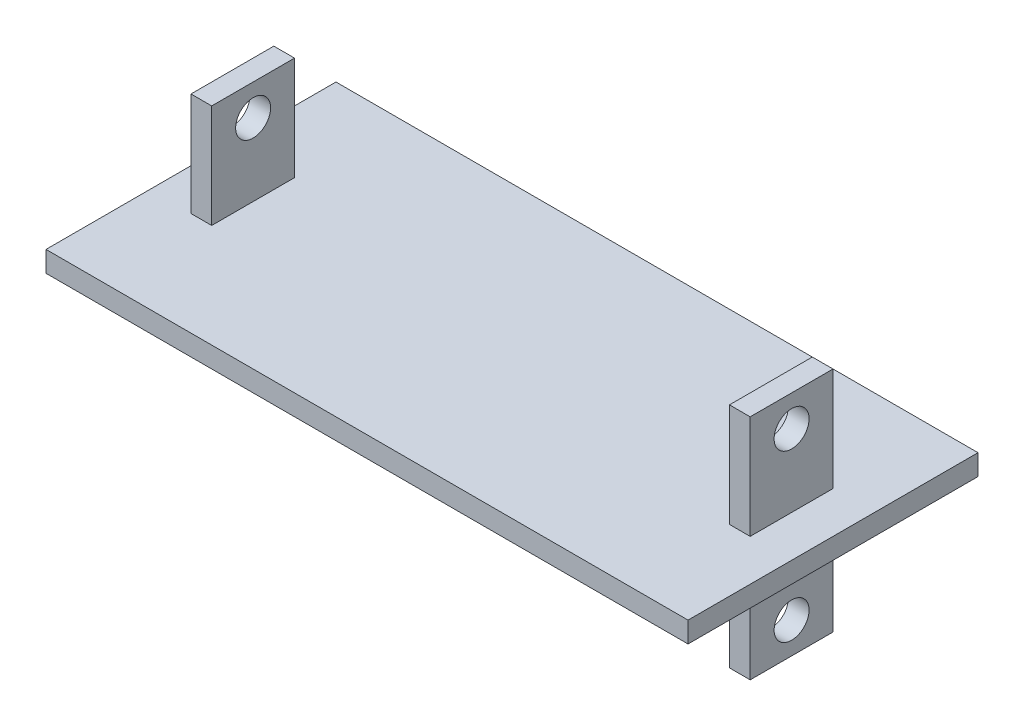
from build123d import *

# Parameters (mm, degrees)
SKETCH1_W               = 196.85
SKETCH1_H               = 88.9
BOSS_EXTRUDE1_DEPTH     = 3.175
SKETCH1_3_W             = 6.35
SKETCH1_3_H             = 25.4
BOSS_EXTRUDE2_DEPTH     = 34.925
CUT_EXTRUDE1_DEPTH      = 193.631203664
CUT_EXTRUDE1_DEPTH_BACK = 193.631203664
SKETCH2_R               = 5.3578125


with BuildPart() as part:
    # Sketch1 → Boss-Extrude1 (new, symmetric)
    with BuildSketch(Plane(origin=(0, 0, 0), x_dir=(1, 0, 0), z_dir=(0, 1, 0))):
        Rectangle(SKETCH1_W, SKETCH1_H)
    extrude(amount=BOSS_EXTRUDE1_DEPTH, both=True)

    # Sketch1<3> → Boss-Extrude2 (add, symmetric)
    with BuildSketch(Plane(origin=(0, 0, 0), x_dir=(1, 0, 0), z_dir=(0, 1, 0))):
        with Locations((-82.55, 0)):
            Rectangle(SKETCH1_3_W, SKETCH1_3_H)
        with Locations((82.55, 0)):
            Rectangle(SKETCH1_3_W, SKETCH1_3_H)
    extrude(amount=BOSS_EXTRUDE2_DEPTH, both=True)

    # Sketch2 → Cut-Extrude1 (cut, two sides: drawn at the far end of the back side and taken through both)
    with BuildSketch(Plane(origin=(85.725, 0, 0), x_dir=(0, 0, -1), z_dir=(1, 0, 0)).offset(-CUT_EXTRUDE1_DEPTH_BACK)):
        with Locations((0, 25.4)):
            Circle(SKETCH2_R)
        with Locations((0, -25.4)):
            Circle(SKETCH2_R)
    extrude(amount=CUT_EXTRUDE1_DEPTH + CUT_EXTRUDE1_DEPTH_BACK, mode=Mode.SUBTRACT)


solid = part.part
